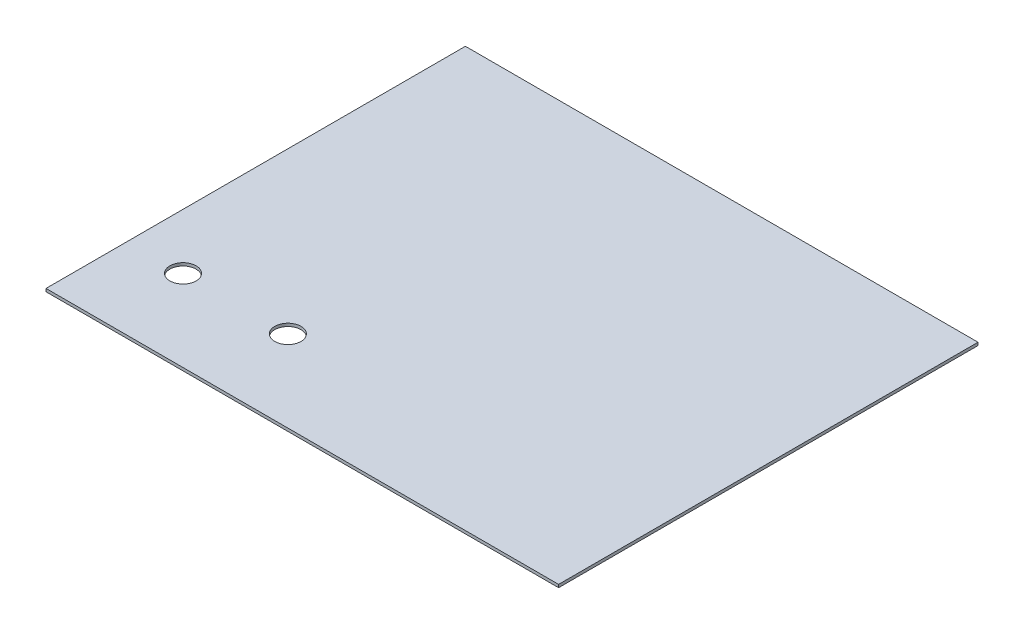
from build123d import *

# Parameters (mm, degrees)
SKETCH1_W           = 558.8
SKETCH1_H           = 457.2
BOSS_EXTRUDE1_DEPTH = 3.175
SKETCH2_R           = 14.2875
CUT_EXTRUDE1_DEPTH  = 3.175


with BuildPart() as part:
    # Sketch1 → Boss-Extrude1 (new body)
    with BuildSketch(Plane(origin=(0, 0, 0), x_dir=(1, 0, 0), z_dir=(0, 1, 0))):
        with Locations((279.4, 228.6)):
            Rectangle(SKETCH1_W, SKETCH1_H)
    extrude(amount=BOSS_EXTRUDE1_DEPTH)

    # Sketch2 → Cut-Extrude1 (cut)
    with BuildSketch(Plane(origin=(0, 3.175, 0), x_dir=(1, 0, 0), z_dir=(0, 1, 0))):
        with Locations((60.460569695, 88.9)):
            Circle(SKETCH2_R)
        with Locations((174.760569695, 88.9)):
            Circle(SKETCH2_R)
    extrude(amount=-CUT_EXTRUDE1_DEPTH, mode=Mode.SUBTRACT)


solid = part.part
